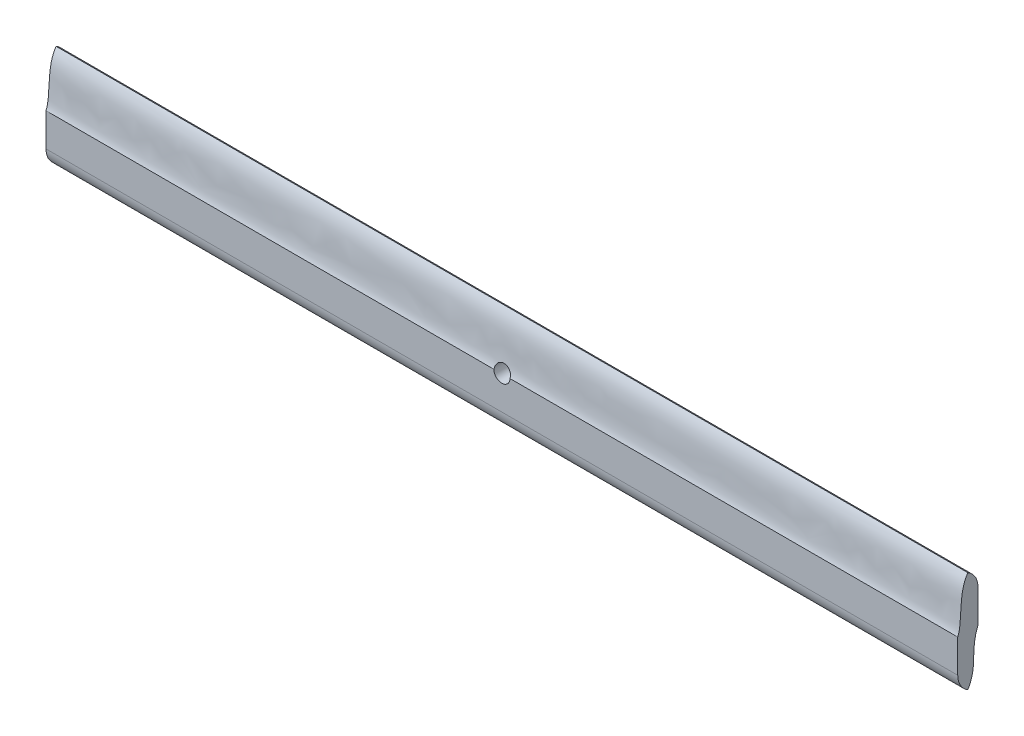
from build123d import *

# Parameters (mm, degrees)
SKETCH2_R           = 1.2
SKETCH2_R_2         = 0.4
BOSS_EXTRUDE1_DEPTH = 1
BOSS_EXTRUDE4_START = -1
SKETCH3_W           = 45
SKETCH3_H           = 5
SKETCH3_R           = 1.2
BOSS_EXTRUDE4_DEPTH = 1
CUT_EXTRUDE1_REACH  = 47.08
FILLET2_R           = 1


with BuildPart() as part:
    # Sketch2 → Boss-Extrude1 (new body)
    with BuildSketch(Plane.XY):
        Circle(SKETCH2_R)
        Circle(SKETCH2_R_2, mode=Mode.SUBTRACT)
    extrude(amount=BOSS_EXTRUDE1_DEPTH)

    # Sketch3 → Boss-Extrude4 (add)
    with BuildSketch(Plane.XY.offset(1).offset(BOSS_EXTRUDE4_START)):
        Rectangle(SKETCH3_W, SKETCH3_H)
        Circle(SKETCH3_R, mode=Mode.SUBTRACT)
    extrude(amount=BOSS_EXTRUDE4_DEPTH)

    # Sketch4 → Cut-Extrude1 (cut, up to next)
    with BuildSketch(Plane(origin=(22.5, 0, 0), x_dir=(0, 0, -1), z_dir=(1, 0, 0)), mode=Mode.PRIVATE) as cut_extrude1_sk1:
        with BuildLine():
            Line((0, -2.5), (0, 0))
            add(Edge.make_bspline(
                [(-0.5, -2.5), (0, -1.669206654), (-0.399128589, -0.925969653), (0, 0)],
                knots=[0, 0, 0, 0, 1, 1, 1, 1], degree=3))
            Line((-0.5, -2.5), (0, -2.5))
        make_face()
    cut_extrude1_tool1 = extrude(cut_extrude1_sk1.sketch, amount=-CUT_EXTRUDE1_REACH, mode=Mode.PRIVATE) & part.part
    # Sketch4 → Cut-Extrude1 (cut, up to next)
    with BuildSketch(Plane(origin=(22.5, 0, 0), x_dir=(0, 0, -1), z_dir=(1, 0, 0)), mode=Mode.PRIVATE) as cut_extrude1_sk2:
        with BuildLine():
            add(Edge.make_bspline(
                [(-0.5, 2.5), (-1, 1.796058275), (-0.732746225, 0.619216624), (-1, 0)],
                knots=[0, 0, 0, 0, 1, 1, 1, 1], degree=3))
            Line((-1, 0), (-1, 2.5))
            Line((-1, 2.5), (-0.5, 2.5))
        make_face()
    cut_extrude1_tool2 = extrude(cut_extrude1_sk2.sketch, amount=-CUT_EXTRUDE1_REACH, mode=Mode.PRIVATE) & part.part
    add(cut_extrude1_tool1.solids().sort_by_distance((22.5, -1.564565, 0.134605))[0], mode=Mode.SUBTRACT)
    add(cut_extrude1_tool2.solids().sort_by_distance((22.5, 1.626929, 0.874071))[0], mode=Mode.SUBTRACT)

    # Fillet2
    # the kernel refuses this fillet: 1 mm, written as the material it takes off along each edge
    with BuildSketch(Plane(origin=(-24.665063509, -2.5, 1), x_dir=(0, 1, 0), z_dir=(1, 0, 0))) as fillet2_piece_1:
        with BuildLine():
            CenterArc((0.866025404, -1), FILLET2_R, 90, 60)
            Line((0, -0.5), (-0.017320508, -0.49))
            ThreePointArc((-0.017320508, -0.49), (-0.02, -0.25), (-0.02, 0))
            Line((-0.02, 0), (0, 0.02))
            Line((0, 0.02), (0.866025404, 0.02))
            Line((0.866025404, 0.02), (0.866025404, 0))
        make_face()
    extrude(amount=49.330127019, mode=Mode.SUBTRACT)
    with BuildSketch(Plane(origin=(24.665063509, 2.5, 0), x_dir=(0, -1, 0), z_dir=(-1, 0, 0))) as fillet2_piece_2:
        with BuildLine():
            CenterArc((0.866025404, 1), FILLET2_R, 210, 60)
            Line((0, 0.5), (-0.017320508, 0.49))
            ThreePointArc((-0.017320508, 0.49), (-0.02, 0.25), (-0.02, 0))
            Line((-0.02, 0), (0, -0.02))
            Line((0, -0.02), (0.866025404, -0.02))
            Line((0.866025404, -0.02), (0.866025404, 0))
        make_face()
    extrude(amount=49.330127019, mode=Mode.SUBTRACT)


solid = part.part
